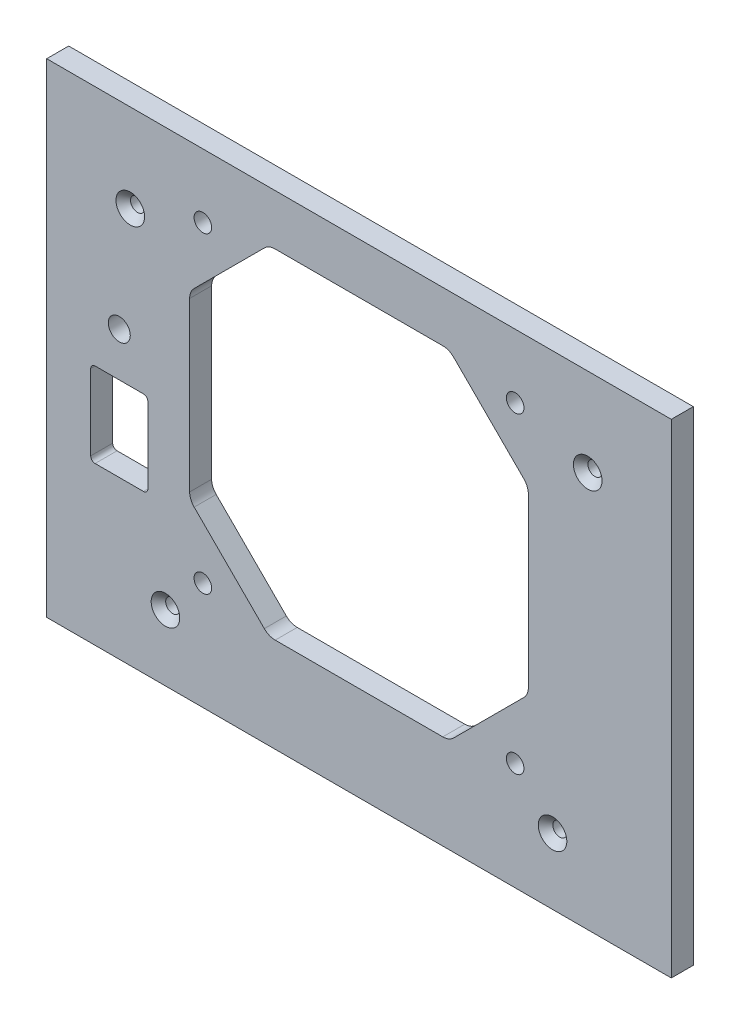
from build123d import *

# Parameters (mm, degrees)
SKETCH1_W                              = 142
SKETCH1_H                              = 110
SHEET_DEPTH                            = 2.5
SKETCH7_R                              = 2
FANHOLES_DEPTH                         = 90.949986103
FILLET1_R                              = 3.5
F_3_2_3_2_TOPMOUNTHOLES_D              = 3.2
F_3_2_3_2_TOPMOUNTHOLES_CSINK_D        = 6.5
F_3_2_3_2_TOPMOUNTHOLES_CSINK_ANGLE    = 90
F_3_2_3_2_BOTTOMMOUNTHOLES_D           = 3.2
F_3_2_3_2_BOTTOMMOUNTHOLES_CSINK_D     = 6.5
F_3_2_3_2_BOTTOMMOUNTHOLES_CSINK_ANGLE = 90
SWITCHSLOT_DEPTH                       = 90.949986103
SKETCH8_R                              = 2.5
LEDHOLE_DEPTH                          = 90.949986103


with BuildPart() as part:
    # Sketch1 → Sheet (new, symmetric)
    with BuildSketch(Plane.XY):
        Rectangle(SKETCH1_W, SKETCH1_H)
    extrude(amount=SHEET_DEPTH, both=True)

    # Sketch7 → FanHoles (cut, through all)
    with BuildSketch(Plane.XY.offset(2.5)):
        with Locations((-35.5, -30.5)):
            Circle(SKETCH7_R)
        with Locations((35.5, -30.5)):
            Circle(SKETCH7_R)
        with Locations((35.5, 40.5)):
            Circle(SKETCH7_R)
        with Locations((-35.5, 40.5)):
            Circle(SKETCH7_R)
        Polygon((-20.5, 43.5), (-38.5, 25.5), (-38.5, -15.5), (-20.5, -33.5), (20.5, -33.5), (38.5, -15.5), (38.5, 25.5), (20.5, 43.5), align=None)
    extrude(amount=-FANHOLES_DEPTH, mode=Mode.SUBTRACT)

    # Fillet1
    fillet1_edges = [part.edges().sort_by_distance(p)[0] for p in [
        (38.5, 25.5, 0),
        (38.5, -15.5, 0),
        (20.5, -33.5, 0),
        (-38.5, -15.5, 0),
        (-38.5, 25.5, 0),
        (-20.5, 43.5, 0),
        (20.5, 43.5, 0),
        (-20.5, -33.5, 0),
    ]]
    fillet(fillet1_edges, radius=FILLET1_R)

    # Ø3.2 (3.2) TopMountHoles (through all)
    with Locations(Plane.XY.offset(2.5)):
        with Locations((-52, 35), (52, 35)):
            CounterSinkHole(F_3_2_3_2_TOPMOUNTHOLES_D / 2, F_3_2_3_2_TOPMOUNTHOLES_CSINK_D / 2, counter_sink_angle=F_3_2_3_2_TOPMOUNTHOLES_CSINK_ANGLE)

    # Ø3.2 (3.2) BottomMountHoles (through all)
    with Locations(Plane.XY.offset(2.5)):
        with Locations((-44, -40), (44, -40)):
            CounterSinkHole(F_3_2_3_2_BOTTOMMOUNTHOLES_D / 2, F_3_2_3_2_BOTTOMMOUNTHOLES_CSINK_D / 2, counter_sink_angle=F_3_2_3_2_BOTTOMMOUNTHOLES_CSINK_ANGLE)

    # Sketch13 → SwitchSlot (cut, through all)
    with BuildSketch(Plane.XY.offset(2.5)):
        with BuildLine():
            Line((-60, 0), (-49, 0))
            ThreePointArc((-49, 0), (-48.292893219, -0.292893219), (-48, -1))
            Line((-48, -1), (-48, -18.2))
            ThreePointArc((-48, -18.2), (-48.292893219, -18.907106781), (-49, -19.2))
            Line((-49, -19.2), (-60, -19.2))
            ThreePointArc((-60, -19.2), (-60.707106781, -18.907106781), (-61, -18.2))
            Line((-61, -18.2), (-61, -1))
            ThreePointArc((-61, -1), (-60.707106781, -0.292893219), (-60, 0))
        make_face()
    extrude(amount=-SWITCHSLOT_DEPTH, mode=Mode.SUBTRACT)

    # Sketch8 → LEDHole (cut, through all)
    with BuildSketch(Plane.XY.offset(2.5)):
        with Locations((-54.5, 10)):
            Circle(SKETCH8_R)
    extrude(amount=-LEDHOLE_DEPTH, mode=Mode.SUBTRACT)


solid = part.part
